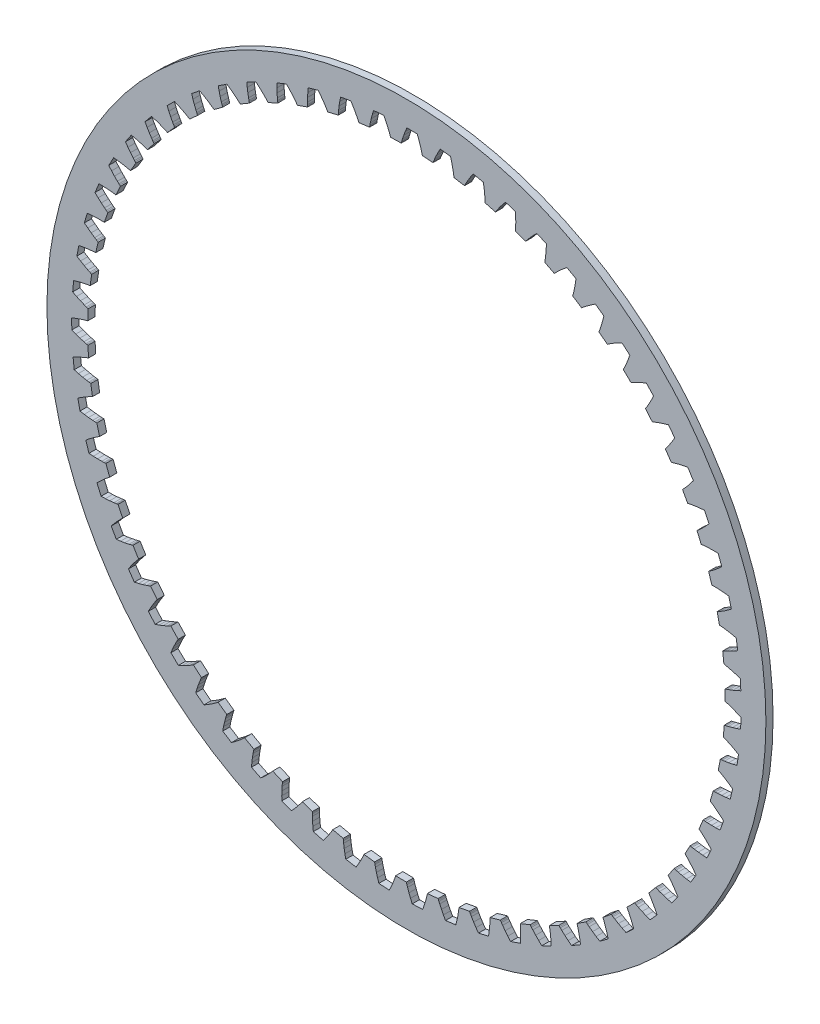
from build123d import *

# Parameters (mm, degrees)
SKETCH1_R           = 254.865124
BOSS_EXTRUDE1_DEPTH = 5.08


with BuildPart() as part:
    # Sketch1 → Boss-Extrude1 (new body)
    with BuildSketch(Plane.XY):
        with Locations((254.865124, 254.865124)):
            Circle(SKETCH1_R)
        Polygon((29.520896, 238.012732), (29.081984, 245.592854), (28.36672, 245.764304), (27.651202, 245.94439), (26.220166, 246.330724), (23.356824, 247.200674), (20.494244, 248.191274), (17.633696, 249.294904), (17.575022, 256.64922), (20.417536, 257.798316), (23.264114, 258.834636), (26.112978, 259.749798), (27.537918, 260.158992), (28.250388, 260.350762), (28.962858, 260.533388), (29.280612, 268.119606), (28.586176, 268.361414), (27.892248, 268.612112), (26.506424, 269.138908), (23.744174, 270.289528), (20.99437, 271.560036), (18.258028, 272.94332), (18.93189, 280.266648), (21.874734, 281.1272), (24.810212, 281.874976), (27.736038, 282.501848), (29.194506, 282.767024), (29.922724, 282.886912), (30.649672, 282.99791), (31.721298, 290.514786), (31.054294, 290.824412), (30.388814, 291.142928), (29.062426, 291.805106), (26.428446, 293.224966), (23.81885, 294.76319), (21.233892, 296.411904), (22.633432, 303.631854), (25.647396, 304.195226), (28.642564, 304.646584), (31.616396, 304.979324), (33.094168, 305.097942), (33.830514, 305.144678), (34.565082, 305.182778), (36.379912, 312.555636), (35.746944, 312.930032), (35.116262, 313.313318), (33.862518, 314.104274), (31.38297, 315.779404), (28.93949, 317.569596), (26.53157, 319.467484), (28.643072, 326.512174), (31.69793, 326.772778), (34.723578, 326.923908), (37.715698, 326.958706), (39.197788, 326.92975), (39.93515, 326.902826), (40.669718, 326.86752), (43.209718, 334.022954), (42.617136, 334.458818), (42.027856, 334.90281), (40.859202, 335.81467), (38.558724, 337.728306), (36.30549, 339.75294), (34.098484, 341.881206), (36.90112, 348.680786), (39.966646, 348.635574), (42.99204, 348.484698), (45.972984, 348.221554), (47.444914, 348.045024), (48.175672, 347.944948), (48.903128, 347.836744), (52.142898, 354.703634), (51.596798, 355.19614), (51.054762, 355.696774), (49.982628, 356.720394), (47.88408, 358.85374), (45.843698, 361.09275), (43.85945, 363.430058), (47.325026, 369.91671), (50.370994, 369.566698), (53.366416, 369.11534), (56.306212, 368.55654), (57.75325, 368.234468), (58.470546, 368.062002), (59.183778, 367.881916), (63.09106, 374.39219), (62.596522, 374.936766), (62.107064, 375.488708), (61.142118, 376.614182), (59.266328, 378.945648), (57.459372, 381.376682), (55.717694, 383.899918), (59.81192, 390.00938), (62.80785, 389.357616), (65.743328, 388.610348), (68.61302, 387.761734), (70.020688, 387.297168), (70.71741, 387.05409), (71.408798, 386.8039), (75.944984, 392.892788), (75.507342, 393.483846), (75.075288, 394.081762), (74.227182, 395.29766), (72.592946, 397.804386), (71.036688, 400.403314), (69.555106, 403.087332), (74.237088, 408.758644), (77.153262, 407.811986), (79.99984, 406.776174), (82.770726, 405.646128), (84.125308, 405.04364), (84.79409, 404.73249), (85.457284, 404.414482), (90.577416, 410.021532), (90.20048, 410.65323), (89.830148, 411.291278), (89.107264, 412.585662), (87.730838, 415.242502), (86.441026, 417.983416), (85.234018, 420.8018), (90.457528, 425.978828), (93.26499, 424.74642), (95.99422, 423.432224), (98.638868, 422.031922), (99.926648, 421.297608), (100.56114, 420.92118), (101.189536, 420.53891), (106.842306, 425.608242), (106.530394, 426.27423), (106.22534, 426.94606), (105.63479, 428.305976), (104.529636, 431.086768), (103.519478, 433.94249), (102.598982, 436.867046), (108.31195, 441.498228), (110.98276, 439.992516), (113.567718, 438.41289), (116.059458, 436.756302), (117.267736, 435.897274), (117.861842, 435.459886), (118.448836, 435.016656), (124.578364, 439.498232), (124.33427, 440.191906), (124.097542, 440.89066), (123.645676, 442.302646), (122.822716, 445.179704), (122.101864, 448.121786), (121.477024, 451.123558), (127.622808, 455.162666), (130.13055, 453.398636), (132.545328, 451.569582), (134.859776, 449.672964), (135.976614, 448.698112), (136.524238, 448.203574), (137.064242, 447.70421), (143.609314, 451.553072), (143.435578, 452.267574), (143.269462, 452.986648), (142.960344, 454.43648), (142.428214, 457.381102), (142.00378, 460.380334), (141.680946, 463.42935), (148.198332, 466.836506), (150.51786, 464.83143), (152.738582, 462.771236), (154.852878, 460.653638), (155.866846, 459.57236), (156.3624, 459.025752), (156.85008, 458.47508), (163.745926, 461.653128), (163.644072, 462.3816), (163.5506, 463.113374), (163.387278, 464.586828), (163.150804, 467.569804), (163.027106, 470.596468), (163.00958, 473.662502), (169.834052, 476.403924), (171.942252, 474.177868), (173.94682, 471.9066), (175.839628, 469.589104), (176.741074, 468.412068), (177.179732, 467.818978), (177.610262, 467.222586), (184.788302, 469.69807), (184.759346, 470.433146), (184.73928, 471.170508), (184.723532, 472.652852), (184.785254, 475.644718), (184.963562, 478.668588), (185.251344, 481.72116), (192.314576, 483.769416), (194.190874, 481.344478), (195.959222, 478.884996), (197.612, 476.390462), (198.39178, 475.129606), (198.769224, 474.495622), (199.138032, 473.859352), (206.526892, 475.607888), (206.571342, 476.342202), (206.624682, 477.07804), (206.756762, 478.554542), (207.115918, 481.525326), (207.594454, 484.51643), (208.18475, 487.52506), (215.417146, 488.85983), (217.042492, 486.26014), (218.557094, 483.636828), (219.953332, 480.990148), (220.603572, 479.657918), (220.915992, 478.989644), (221.219776, 478.319846), (228.74605, 479.323908), (228.863398, 480.050094), (228.989636, 480.776788), (229.26802, 482.23297), (229.921308, 485.153208), (230.695246, 488.081828), (231.582214, 491.016798), (238.911384, 491.624874), (240.27003, 488.87634), (241.5159, 486.115106), (242.641628, 483.342696), (243.155978, 481.9523), (243.400326, 481.256086), (243.635784, 480.559364), (251.224542, 480.8093), (251.413772, 481.519992), (251.611892, 482.230684), (252.033786, 483.651814), (252.974602, 486.492296), (254.036322, 489.329476), (255.211072, 492.161576), (262.564372, 492.036862), (263.642348, 489.166662), (264.607294, 486.295192), (265.451336, 483.42423), (265.824716, 481.989638), (265.998706, 481.272596), (266.163552, 480.555808), (273.73961, 480.048824), (273.998436, 480.737164), (274.266406, 481.424742), (274.827746, 482.79685), (276.046692, 485.529636), (277.385526, 488.246928), (278.836374, 490.947964), (286.140652, 490.09173), (286.927798, 487.128312), (287.601914, 484.175054), (288.155888, 481.234496), (288.384488, 479.769678), (288.486088, 479.03892), (288.579052, 478.309432), (296.066718, 477.050608), (296.393108, 477.709738), (296.72788, 478.36709), (297.423078, 479.67646), (298.908216, 482.274372), (300.510956, 484.844852), (302.223424, 487.3879), (309.40629, 485.808782), (309.894224, 482.781864), (310.27116, 479.776028), (310.529478, 476.79483), (310.611266, 475.314772), (310.639714, 474.57741), (310.659272, 473.842334), (317.984632, 471.844116), (318.374776, 472.467686), (318.773556, 473.088462), (319.5955, 474.321886), (321.331844, 476.759016), (323.182742, 479.157284), (325.140066, 481.517198), (332.129892, 479.230436), (332.314042, 476.16999), (332.389734, 473.141802), (332.35011, 470.149682), (332.28407, 468.668608), (332.238858, 467.932262), (332.18501, 467.19871), (339.275166, 464.481164), (339.725508, 465.062824), (340.183978, 465.640674), (341.124794, 466.786468), (343.095072, 469.038432), (345.175586, 471.240358), (347.357954, 473.39377), (354.085398, 470.422478), (353.963986, 467.358984), (353.737926, 464.338162), (353.40036, 461.364838), (353.187254, 459.897734), (353.06889, 459.169516), (352.942398, 458.445108), (359.726738, 455.035158), (360.232706, 455.568812), (360.746548, 456.098402), (361.796584, 457.144628), (363.981492, 459.189328), (366.270794, 461.173068), (368.65687, 463.098388), (375.05513, 459.472284), (374.629172, 456.435968), (374.103392, 453.452738), (373.47144, 450.527928), (373.1133, 449.089272), (372.923054, 448.376548), (372.725188, 447.668142), (379.136148, 443.59957), (379.692662, 444.080392), (380.256796, 444.55588), (381.405892, 445.492378), (383.783332, 447.309494), (386.258816, 449.05549), (388.824724, 450.733668), (394.830046, 446.488312), (394.104114, 443.509654), (393.283694, 440.593734), (392.363706, 437.74614), (391.864088, 436.35041), (391.603992, 435.660038), (391.33653, 434.975), (397.310356, 430.288446), (397.912082, 430.711102), (398.520666, 431.128424), (399.757392, 431.945796), (402.303996, 433.51704), (404.941024, 435.00802), (407.661364, 436.422292), (413.214058, 431.600102), (412.19501, 428.708566), (411.088332, 425.888658), (409.889706, 423.146982), (409.253436, 421.807894), (408.925776, 421.146732), (408.591512, 420.491666), (414.069022, 415.233612), (414.709864, 415.594546), (415.357056, 415.948876), (416.668966, 416.639248), (419.359334, 417.949126), (422.131744, 419.170104), (424.979338, 420.3065), (430.024286, 414.955482), (428.722536, 412.179516), (427.340522, 409.484068), (425.874688, 406.875234), (425.10837, 405.60625), (424.716702, 404.981156), (424.318684, 404.362412), (429.245522, 398.585182), (429.91913, 398.88033), (430.598326, 399.16862), (431.972466, 399.72488), (434.779928, 400.760438), (437.660034, 401.699222), (440.606688, 402.546566), (445.093852, 396.719806), (443.521846, 394.08735), (441.878466, 391.542524), (440.160156, 389.092694), (439.27141, 387.90626), (438.81929, 387.32333), (438.361836, 386.747512), (442.68898, 380.508256), (443.388496, 380.735078), (444.093092, 380.95428), (445.515746, 381.37084), (448.412362, 382.121664), (451.371462, 382.76911), (454.387966, 383.318766), (458.272642, 377.074176), (456.446636, 374.611392), (454.557892, 372.242842), (452.604378, 369.9764), (451.60184, 368.8842), (451.09384, 368.349276), (450.581268, 367.821718), (454.265538, 361.182666), (454.984358, 361.338622), (455.707242, 361.486704), (457.164186, 361.7595), (460.121254, 362.218224), (463.130138, 362.567728), (466.186266, 362.814362), (469.4301, 356.213918), (467.36762, 353.94519), (465.252816, 351.776538), (463.083148, 349.715836), (461.976724, 348.729046), (461.417924, 348.247208), (460.855568, 347.773498), (463.860642, 340.800436), (464.591146, 340.884002), (465.325206, 340.95944), (466.802216, 341.085932), (469.790272, 341.247984), (472.818968, 341.29599), (475.884494, 341.237062), (478.454974, 334.34655), (476.176848, 332.294484), (473.856558, 330.34732), (471.492326, 328.512678), (470.293446, 327.64095), (469.689434, 327.217278), (469.082628, 326.801734), (471.37828, 319.564258), (472.113864, 319.574672), (472.85148, 319.57645), (474.333824, 319.555368), (477.32315, 319.41897), (480.341686, 319.165478), (483.38613, 318.801496), (485.257602, 311.689242), (482.78669, 309.874158), (480.283774, 308.167532), (477.748854, 306.577746), (476.468948, 305.829462), (475.82582, 305.46802), (475.18066, 305.115214), (476.744538, 297.684952), (477.477328, 297.622214), (478.211642, 297.550586), (479.684334, 297.38193), (482.645212, 296.948606), (485.623616, 296.395648), (488.616498, 295.730422), (489.770674, 288.467292), (487.131106, 286.907224), (484.470964, 285.458408), (481.790248, 284.128718), (480.44227, 283.511752), (479.766376, 283.215842), (479.089212, 282.929076), (479.905314, 275.380196), (480.628198, 275.24456), (481.351844, 275.100288), (482.800406, 274.785836), (485.703372, 274.059904), (488.611926, 273.213068), (491.523782, 272.253202), (491.948978, 264.911332), (489.167424, 263.621774), (486.375964, 262.444992), (483.576376, 261.38886), (482.173534, 260.909054), (481.471478, 260.682232), (480.769168, 260.464046), (480.82962, 252.871478), (481.535486, 252.664722), (482.241098, 252.448822), (483.651306, 251.991622), (486.467658, 250.980448), (489.277152, 249.84837), (492.079026, 248.603262), (491.771178, 241.255296), (488.874816, 240.249202), (485.980232, 239.356138), (483.089458, 238.583978), (481.645722, 238.246412), (480.924616, 238.090456), (480.204018, 237.94339), (479.508312, 230.382572), (480.190048, 230.106474), (480.870514, 229.821486), (482.228398, 229.226364), (484.929942, 227.9396), (487.612944, 226.533202), (490.276896, 225.015552), (489.238798, 217.734896), (486.256838, 217.021918), (483.287832, 216.421716), (480.334066, 215.941148), (478.864168, 215.74887), (478.131124, 215.665558), (477.39935, 215.591136), (475.954344, 208.136998), (476.605346, 207.794352), (477.254062, 207.44307), (478.545652, 206.715614), (481.105718, 205.166214), (483.635304, 203.499974), (486.134918, 201.724514), (484.377238, 194.583304), (481.33889, 194.170808), (478.324926, 193.869056), (475.33814, 193.68516), (473.856304, 193.640202), (473.118688, 193.630296), (472.383104, 193.629026), (470.203022, 186.355736), (470.816686, 185.950098), (471.427302, 185.536078), (472.639898, 184.6834), (475.033086, 182.886858), (477.384364, 180.977032), (479.694748, 178.961542), (477.234504, 172.030644), (474.170502, 171.922948), (471.141298, 171.922694), (468.150956, 172.036994), (466.672168, 172.139864), (465.937092, 172.203618), (465.205064, 172.2755), (462.31175, 165.255448), (462.881726, 164.790628), (463.448146, 164.317934), (464.570064, 163.348924), (466.772244, 161.32302), (468.921592, 159.188404), (471.019886, 156.952696), (467.88197, 150.301452), (464.822286, 150.499318), (461.808068, 150.800816), (458.844142, 151.212296), (457.38288, 151.461978), (456.65771, 151.598376), (455.936604, 151.742648), (452.35876, 145.045684), (452.879714, 144.526508), (453.396096, 143.999712), (454.415906, 142.923768), (456.405488, 140.688568), (458.33157, 138.350752), (460.196946, 135.917178), (456.412092, 129.611374), (453.38746, 130.113024), (450.4182, 130.712972), (447.510154, 131.417568), (446.080896, 131.811522), (445.372998, 132.019294), (444.669926, 132.23494), (440.442858, 125.927358), (440.909456, 125.358906), (441.370974, 124.783342), (442.278516, 123.611132), (444.035688, 121.188988), (445.719454, 118.670832), (447.333116, 116.06403), (442.939424, 110.166404), (439.979562, 110.966504), (437.084978, 111.85906), (434.26126, 112.84966), (432.878484, 113.384076), (432.19497, 113.661444), (431.516536, 113.945924), (426.682662, 108.090716), (427.090332, 107.478576), (427.49216, 106.859832), (428.278544, 105.60304), (429.78578, 103.018082), (431.210466, 100.344732), (432.556666, 97.590102), (427.59757, 92.159074), (424.732196, 93.250004), (421.940736, 94.426532), (419.229794, 95.693484), (417.906962, 96.36252), (417.254436, 96.70669), (416.607752, 97.05721), (411.214824, 91.712542), (411.559502, 91.06281), (411.89783, 90.406982), (412.555182, 89.078308), (413.797496, 86.35619), (414.948878, 83.554316), (416.014154, 80.67929), (410.53893, 75.769216), (407.796238, 77.1398), (405.136096, 78.588362), (402.5646, 80.118966), (401.31492, 80.916526), (400.699986, 81.323942), (400.091402, 81.7372), (394.193014, 76.955904), (394.471398, 76.27493), (394.74267, 75.588876), (395.264386, 74.201274), (396.229586, 71.36892), (397.096488, 68.466462), (397.869918, 65.499488), (391.933176, 61.158882), (389.340598, 62.795912), (386.837682, 64.502284), (384.43154, 66.281046), (383.267712, 67.199256), (382.695958, 67.665854), (382.131824, 68.137532), (375.78665, 63.96736), (375.995946, 63.262256), (376.197368, 62.55258), (376.578368, 61.119766), (377.256802, 58.20537), (377.830334, 55.23103), (378.304552, 52.201826), (371.964966, 48.473868), (369.54841, 50.360834), (367.227866, 52.307998), (365.0107, 54.317646), (363.944154, 55.347108), (363.42193, 55.868062), (362.907326, 56.393842), (356.178358, 52.875942), (356.316534, 52.153566), (356.446328, 51.42738), (356.682802, 49.963832), (357.067612, 46.99635), (357.342186, 43.979592), (357.512366, 40.918384), (350.833182, 37.840158), (348.616524, 39.958264), (346.501466, 42.126916), (344.495374, 44.34713), (343.536524, 45.477684), (343.068656, 46.048168), (342.60917, 46.622462), (335.563464, 43.79214), (335.628742, 43.059604), (335.685638, 42.32402), (335.7753, 40.844216), (335.862676, 37.853112), (335.835498, 34.824162), (335.700116, 31.761176), (328.747628, 29.363162), (326.752966, 31.69158), (324.864222, 34.059876), (323.08927, 36.469066), (322.247514, 37.689282), (321.838828, 38.303708), (321.438778, 38.920928), (314.146438, 36.806124), (314.13831, 36.07054), (314.1218, 35.332924), (314.063634, 33.85185), (313.852814, 30.866842), (313.524138, 27.855418), (313.084464, 24.821134), (305.92776, 23.127462), (304.174906, 25.643078), (302.531272, 28.187396), (301.004986, 30.761432), (300.28896, 32.059372), (299.94352, 32.71139), (299.60697, 33.365186), (292.140132, 31.987236), (292.058852, 31.256224), (291.968936, 30.523942), (291.763704, 29.055822), (291.25672, 26.106628), (290.629848, 23.142956), (289.8902, 20.1676), (282.6004, 19.19478), (281.106626, 21.872448), (279.724612, 24.567896), (278.461978, 27.28087), (277.879048, 28.643834), (277.600156, 29.32684), (277.330408, 30.011116), (269.763494, 29.383228), (269.609824, 28.6639), (269.447518, 27.944318), (269.096998, 26.503884), (268.29893, 23.619968), (267.379958, 20.733512), (266.347702, 17.846548), (258.99745, 17.604486), (257.777742, 20.417282), (256.67081, 23.23719), (255.684782, 26.062432), (255.240282, 27.47645), (255.030986, 28.184094), (254.830326, 28.891738), (247.23852, 29.020262), (247.014238, 28.319984), (246.781066, 27.61996), (246.288814, 26.22169), (245.207536, 23.4315), (244.005862, 20.650962), (242.691412, 17.880838), (235.353352, 18.372074), (234.419648, 21.292312), (233.599228, 24.208232), (232.899204, 27.117548), (232.597706, 28.569158), (232.460038, 29.29382), (232.331006, 30.017974), (224.789746, 30.901894), (224.49663, 30.22727), (224.194878, 29.55417), (223.565974, 28.21178), (222.212154, 25.543002), (220.739462, 22.896068), (219.155772, 20.270724), (211.90331, 21.489924), (211.265008, 24.488648), (210.73872, 27.471878), (210.332066, 30.436566), (210.176618, 31.910782), (210.111594, 32.645604), (210.05546, 33.378902), (202.639676, 35.009582), (202.280774, 34.36747), (201.91349, 33.727644), (201.15403, 32.454342), (199.541384, 29.9339), (197.812406, 27.446478), (195.975224, 24.991822), (188.879988, 26.927302), (188.543438, 29.974794), (188.317124, 32.995362), (188.20765, 35.985704), (188.199776, 37.468302), (188.208158, 38.205918), (188.225176, 38.941248), (181.008528, 41.301924), (180.58765, 40.698674), (180.15839, 40.098726), (179.275994, 38.907466), (177.42027, 36.559998), (175.452278, 34.257234), (173.379892, 31.99765), (166.512748, 34.629852), (166.481252, 37.695632), (166.55669, 40.724074), (166.745412, 43.710352), (166.885112, 45.186346), (166.967154, 45.91939), (167.057324, 46.649386), (160.11144, 49.716944), (159.63265, 49.158652), (159.145986, 48.60417), (158.14929, 47.50689), (156.06903, 45.355764), (153.881582, 43.260264), (151.594312, 41.218612), (145.023332, 44.521374), (145.297398, 47.574962), (145.673826, 50.580798), (146.15922, 53.533548), (146.445224, 54.988206), (146.599656, 55.709566), (146.761962, 56.426862), (140.156184, 60.170822), (139.624308, 59.662822), (139.084558, 59.159902), (137.983468, 58.167016), (135.6995, 56.233822), (133.31444, 54.366668), (130.835146, 52.562506), (124.625608, 56.503316), (125.202442, 59.514486), (125.876304, 62.467744), (126.653036, 65.357502), (127.08255, 66.7766), (127.308102, 67.47891), (127.54102, 68.176648), (121.34088, 72.559672), (120.760998, 72.107298), (120.174004, 71.660258), (118.979696, 70.78218), (116.514372, 69.085968), (113.955068, 67.465448), (111.308642, 65.917318), (105.522522, 70.456552), (106.396028, 73.395586), (107.36072, 76.267056), (108.421424, 79.06512), (108.989876, 80.43418), (109.284262, 81.110836), (109.585506, 81.78165), (103.852726, 86.760304), (103.23068, 86.367874), (102.60203, 85.98154), (101.326188, 85.226652), (98.7044, 83.78444), (95.996506, 82.42681), (93.208856, 81.149698), (87.903304, 86.242652), (89.065354, 89.080086), (90.311224, 91.84132), (91.645232, 94.51975), (92.347034, 95.825564), (92.70746, 96.4692), (93.073982, 97.106994), (87.865204, 102.631494), (87.20709, 102.303072), (86.543388, 101.981254), (85.198458, 101.357176), (82.446114, 100.183188), (79.616554, 99.10191), (76.715874, 98.10877), (71.943722, 103.704644), (73.382378, 106.412284), (74.89698, 109.035596), (76.49083, 111.567976), (77.319378, 112.797336), (77.742034, 113.40211), (78.170278, 114.000026), (73.537572, 120.015762), (72.849994, 119.754396), (72.157336, 119.500396), (70.757288, 119.013478), (67.901566, 118.119144), (64.97828, 117.32514), (61.993272, 116.625624), (57.802018, 122.668792), (59.503056, 125.219714), (61.27115, 127.679196), (63.109602, 130.04038), (64.05626, 131.181094), (64.537082, 131.74091), (65.02273, 132.293106), (61.01207, 138.740388), (60.301886, 138.548872), (59.587384, 138.364976), (58.14568, 138.01979), (55.215282, 137.414254), (52.22748, 136.915144), (49.187354, 136.516364), (45.618654, 142.946882), (47.56531, 145.315686), (49.569624, 147.586954), (51.633882, 149.75332), (52.689506, 150.794212), (53.223668, 151.303228), (53.761894, 151.80437), (50.412904, 158.618936), (49.687226, 158.499048), (48.957992, 158.387288), (47.48911, 158.18739), (44.512992, 157.876494), (41.490392, 157.677358), (38.425628, 157.583378), (35.515042, 164.337238), (37.688012, 166.500556), (39.90848, 168.561004), (42.17797, 170.510962), (43.332146, 171.441364), (43.914314, 171.894754), (44.499784, 172.340016), (41.845992, 179.454048), (41.111932, 179.407058), (40.375078, 179.36845), (38.89375, 179.315618), (35.901376, 179.302918), (32.87395, 179.405534), (29.815282, 179.61737), (27.591512, 186.627516), (29.968698, 188.563504), (32.383476, 190.392558), (34.8361, 192.107058), (36.07689, 192.917826), (36.701222, 193.311018), (37.328094, 193.695574), (35.395916, 201.038714), (34.66084, 201.064876), (33.923986, 201.099928), (32.444436, 201.194924), (29.465778, 201.480166), (26.463752, 201.883772), (23.441152, 202.398884), (21.92655, 209.59572), (24.484838, 211.285328), (27.069542, 212.864954), (29.680662, 214.326724), (30.996128, 215.009984), (31.656528, 215.339168), (32.318706, 215.659462), (31.127192, 223.158304), (30.398466, 223.257364), (29.66847, 223.365568), (28.205938, 223.60763), (25.27046, 224.187766), (22.323298, 224.888552), (19.367246, 225.702114), (18.576544, 233.013758), (21.290534, 234.440476), (24.019764, 235.754926), (26.763472, 236.949234), (28.140406, 237.498128), (28.83027, 237.759748), align=None, mode=Mode.SUBTRACT)
    extrude(amount=BOSS_EXTRUDE1_DEPTH)


solid = part.part
